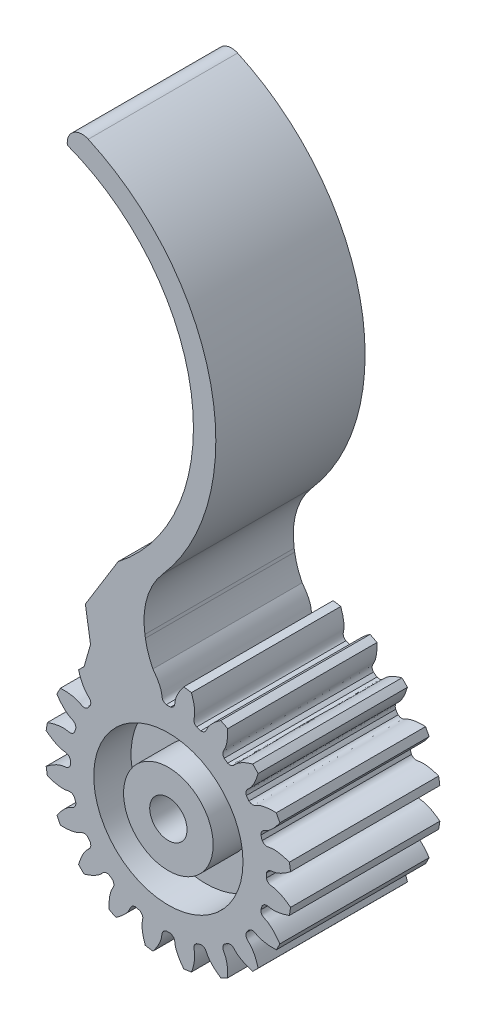
from build123d import *

# Parameters (mm, degrees)
SKETCH_1_R               = 16.5
EXTRUDE_1_DEPTH          = 20
CUT_EXTRUDE_1_DEPTH      = 31.732718721
PATTERN_CIRCULAR_1_COUNT = 20
EXTRUDE_START            = -20
EXTRUDE_2_DEPTH          = 20
FILLET_1_R               = 10
FILLET_2_R               = 2
FILLET_4_R               = 10
SKETCH_5_R               = 2.5
CUT_EXTRUDE_2_DEPTH      = 20
SKETCH_7_R               = 10
CUT_EXTRUDE_3_DEPTH      = 3
CUT_EXTRUDE_START        = -5
SKETCH_8_R               = 10
SKETCH_8_R_2             = 6
CUT_EXTRUDE_4_DEPTH      = 5


with BuildPart() as part:
    # 草图1 → 凸台-拉伸1 (new body)
    with BuildSketch(Plane.XY):
        Circle(SKETCH_1_R)
    extrude(amount=EXTRUDE_1_DEPTH)

    # 草图2 → 切除-拉伸1 (cut, through all)
    with BuildSketch(Plane.XY):
        with BuildLine():
            ThreePointArc((0.289974901, 13.121796354), (0, 13.125), (-0.289974901, 13.121796354))
            add(Edge.make_bspline(
                [(-0.289974901, 13.121796354), (-0.916784107, 13.340213268), (-0.835626149, 13.780670548), (-0.919345585, 14.205014104), (-0.928338279, 14.246334921), (-0.939466335, 14.292951923), (-0.952938145, 14.344795254), (-0.96896871, 14.401787245), (-0.987768083, 14.463844242), (-1.009544807, 14.5308761), (-1.034504625, 14.602786421), (-1.06285065, 14.679472568), (-1.094783098, 14.760825751), (-1.130499153, 14.846731096), (-1.170192797, 14.937067727), (-1.214054647, 15.031708847), (-1.2622718, 15.130521826), (-1.315027675, 15.233368292), (-1.372501858, 15.340104225), (-1.434869948, 15.450580056), (-1.502303414, 15.564640771), (-1.574969439, 15.682126017), (-1.653030782, 15.802870208), (-1.736645634, 15.926702646), (-1.825967477, 16.05344763), (-1.921144951, 16.182924586), (-2.022321721, 16.314948181), (-2.129636342, 16.449328459), (-2.24322214, 16.585870967), (-2.363207078, 16.724376892), (-2.489713645, 16.864643194), (-2.622858733, 17.006462752), (-2.762753527, 17.149624504), (-2.909503389, 17.29391359), (-3.06320776, 17.439111509), (-3.223960048, 17.584996263), (-3.391847534, 17.731342516), (-3.566951278, 17.877921749), (-3.749346018, 18.024502419), (-3.939100102, 18.170850122), (-4.136275349, 18.31672776), (-4.412210386, 18.512459802), (-4.625898619, 18.654498902), (-4.771736973, 18.747377789)],
                knots=[0, 0, 0, 0, 0.165916003, 0.170905922, 0.176663519, 0.183188797, 0.190481754, 0.198542391, 0.207370708, 0.216966704, 0.22733038, 0.238461736, 0.250360771, 0.263027487, 0.276461881, 0.290663956, 0.30563371, 0.321371144, 0.337876258, 0.355149051, 0.373189524, 0.391997677, 0.411573509, 0.431917021, 0.453028213, 0.474907084, 0.497553636, 0.520967867, 0.545149777, 0.570099367, 0.595816637, 0.622301587, 0.649554216, 0.677574526, 0.706362514, 0.735918183, 0.766241531, 0.797332559, 0.829191267, 0.861817654, 0.895211721, 0.929373468, 1, 1, 1, 1], degree=3))
            ThreePointArc((-4.771736973, 18.747377789), (0, 19.345119481), (4.771736973, 18.747377789))
            add(Edge.make_bspline(
                [(0.289974901, 13.121796354), (0.916784107, 13.340213268), (0.835626149, 13.780670548), (0.919345585, 14.205014104), (0.928338279, 14.246334921), (0.939466335, 14.292951923), (0.952938145, 14.344795254), (0.96896871, 14.401787245), (0.987768083, 14.463844242), (1.009544807, 14.5308761), (1.034504625, 14.602786421), (1.06285065, 14.679472568), (1.094783098, 14.760825751), (1.130499153, 14.846731096), (1.170192797, 14.937067727), (1.214054647, 15.031708847), (1.2622718, 15.130521826), (1.315027675, 15.233368292), (1.372501858, 15.340104225), (1.434869948, 15.450580056), (1.502303414, 15.564640771), (1.574969439, 15.682126017), (1.653030782, 15.802870208), (1.736645634, 15.926702646), (1.825967477, 16.05344763), (1.921144951, 16.182924586), (2.022321721, 16.314948181), (2.129636342, 16.449328459), (2.24322214, 16.585870967), (2.363207078, 16.724376892), (2.489713645, 16.864643194), (2.622858733, 17.006462752), (2.762753527, 17.149624504), (2.909503389, 17.29391359), (3.06320776, 17.439111509), (3.223960048, 17.584996263), (3.391847534, 17.731342516), (3.566951278, 17.877921749), (3.749346018, 18.024502419), (3.939100102, 18.170850122), (4.136275349, 18.31672776), (4.412210386, 18.512459802), (4.625898619, 18.654498902), (4.771736973, 18.747377789)],
                knots=[0, 0, 0, 0, 0.165916003, 0.170905922, 0.176663519, 0.183188797, 0.190481754, 0.198542391, 0.207370708, 0.216966704, 0.22733038, 0.238461736, 0.250360771, 0.263027487, 0.276461881, 0.290663956, 0.30563371, 0.321371144, 0.337876258, 0.355149051, 0.373189524, 0.391997677, 0.411573509, 0.431917021, 0.453028213, 0.474907084, 0.497553636, 0.520967867, 0.545149777, 0.570099367, 0.595816637, 0.622301587, 0.649554216, 0.677574526, 0.706362514, 0.735918183, 0.766241531, 0.797332559, 0.829191267, 0.861817654, 0.895211721, 0.929373468, 1, 1, 1, 1], degree=3))
        make_face()
    cut_extrude_1 = extrude(amount=CUT_EXTRUDE_1_DEPTH, mode=Mode.SUBTRACT)

    # 阵列(圆周)1: 切除-拉伸1 ×20 about axis
    pattern_circular_1_axis = Axis((0, 0, -1.5), (0, 0, 1))
    for i in range(1, PATTERN_CIRCULAR_1_COUNT):
        add(cut_extrude_1.rotate(pattern_circular_1_axis, i * 360 / PATTERN_CIRCULAR_1_COUNT), mode=Mode.SUBTRACT)


with BuildPart() as extrude_2_tool:
    # 草图4 → 凸台-拉伸2 (new body)
    with BuildSketch(Plane.XY.offset(20).offset(EXTRUDE_START)):
        with BuildLine():
            Line((-3.093231062, 16.207464996), (-2.581168673, 16.29685762))
            Line((-2.581168673, 16.29685762), (-3.943179305, 24.896254312))
            ThreePointArc((-3.943179305, 24.896254312), (5.496479925, 54.08322336), (-16.546718658, 75.415914817))
            Line((-16.546718658, 75.415914817), (-13.532827403, 71.415914817))
            ThreePointArc((-13.532827403, 71.415914817), (3.341214432, 48.022182491), (-11.762983934, 23.448554518))
            Line((-11.762983934, 23.448554518), (-10.429455191, 15.028985398))
            Line((-10.429455191, 15.028985398), (-9.866251186, 11.473055258))
            add(Edge.make_bspline(
                [(-9.86625116, 11.473055308), (-9.818790017, 11.447845476), (-9.715705209, 11.391138486), (-9.589612349, 11.315967266), (-9.466858859, 11.237556123), (-9.37982057, 11.17834971), (-9.300755502, 11.120900284), (-9.249070303, 11.081745113), (-9.202602252, 11.045060153), (-9.150343301, 11.002082969), (-9.104978437, 10.962582681), (-8.776110671, 10.657627941), (-8.582874544, 10.253587065), (-7.947393003, 10.445313277)],
                knots=[0.701586416, 0.701586416, 0.701586416, 0.701586416, 0.723538119, 0.749639229, 0.761538264, 0.783033296, 0.792629292, 0.801457609, 0.809518246, 0.816811203, 0.829094078, 0.834083997, 1, 1, 1, 1], degree=3))
            ThreePointArc((-7.947393003, 10.445313277), (-7.714681436, 10.618348051), (-7.478203758, 10.786199217))
            add(Edge.make_bspline(
                [(-7.478203758, 10.786199217), (-7.099486698, 11.33133142), (-7.424039159, 11.639965394), (-7.612442624, 12.046973423), (-7.635991116, 12.102324233), (-7.660715943, 12.16530613), (-7.681245996, 12.220836149), (-7.71083511, 12.306060717), (-7.748703597, 12.427161912), (-7.792731572, 12.590510669), (-7.835215538, 12.777480211), (-7.874329115, 12.988173006), (-7.908236264, 13.222583157), (-7.935097524, 13.480595599), (-7.953075711, 13.761985925), (-7.960341751, 14.066420428), (-7.956565619, 14.30111124), (-7.951281332, 14.434194698), (-7.950219677, 14.458354231)],
                knots=[0, 0, 0, 0, 0.165916003, 0.170905922, 0.183188797, 0.190481754, 0.198542391, 0.207370708, 0.22733038, 0.250360771, 0.276461881, 0.30563371, 0.337876258, 0.373189524, 0.411573509, 0.453028213, 0.497553636, 0.507431698, 0.507431698, 0.507431698, 0.507431698], degree=3))
            ThreePointArc((-7.950219677, 14.458354231), (-7.490843246, 14.701607649), (-7.024032405, 14.930270218))
            add(Edge.make_bspline(
                [(-7.024032405, 14.930270218), (-6.912948778, 14.856790614), (-6.720224904, 14.722766352), (-6.458979768, 14.52326582), (-6.24189748, 14.343324096), (-6.048949658, 14.169936981), (-5.879237949, 14.004722705), (-5.731774221, 13.849237063), (-5.623437121, 13.725477592), (-5.530921989, 13.612971249), (-5.466439445, 13.529766293), (-5.408996946, 13.450696193), (-5.371941014, 13.397485807), (-5.339083547, 13.34823692), (-5.302663012, 13.291214284), (-5.271724722, 13.239628764), (-5.053189088, 12.847973843), (-4.994266108, 12.403994888), (-4.330640589, 12.389962756)],
                knots=[0.492568302, 0.492568302, 0.492568302, 0.492568302, 0.546971787, 0.588426491, 0.626810476, 0.662123742, 0.69436629, 0.723538119, 0.749639229, 0.761538264, 0.783033296, 0.792629292, 0.801457609, 0.809518246, 0.816811203, 0.829094078, 0.834083997, 1, 1, 1, 1], degree=3))
            ThreePointArc((-4.330640589, 12.389962756), (-4.055848051, 12.482616776), (-3.779075551, 12.5691771))
            add(Edge.make_bspline(
                [(-3.779075551, 12.5691771), (-3.250439109, 12.970598627), (-3.463733699, 13.364419205), (-3.517143644, 13.809726715), (-3.522435249, 13.869645348), (-3.526487481, 13.937185083), (-3.528853002, 13.996341404), (-3.530658082, 14.086538325), (-3.529250826, 14.213414411), (-3.520646377, 14.382373703), (-3.503274264, 14.573320573), (-3.475365832, 14.785788088), (-3.435176726, 15.019203275), (-3.380993074, 15.272888275), (-3.311136952, 15.546061943), (-3.223971932, 15.837841691), (-3.147857168, 16.059879028), (-3.101706462, 16.184815984), (-3.093231062, 16.207464996)],
                knots=[0, 0, 0, 0, 0.165916003, 0.170905922, 0.183188797, 0.190481754, 0.198542391, 0.207370708, 0.22733038, 0.250360771, 0.276461881, 0.30563371, 0.337876258, 0.373189524, 0.411573509, 0.453028213, 0.497553636, 0.507431698, 0.507431698, 0.507431698, 0.507431698], degree=3))
        make_face()
        with BuildLine():
            Line((-9.866251186, 11.473055258), (-10.429455191, 15.028985398))
            Line((-10.429455191, 15.028985398), (-11.293959017, 12.028985398))
            add(Edge.make_bspline(
                [(-11.293959017, 12.028985398), (-11.165605763, 11.993428871), (-10.940898693, 11.925519176), (-10.630790749, 11.816512081), (-10.368728174, 11.712459448), (-10.131644325, 11.607182659), (-9.967401155, 11.526255764), (-9.881861585, 11.481347063), (-9.86625116, 11.473055308)],
                knots=[0.492568302, 0.492568302, 0.492568302, 0.492568302, 0.546971787, 0.588426491, 0.626810476, 0.662123742, 0.69436629, 0.701586416, 0.701586416, 0.701586416, 0.701586416], degree=3))
        make_face()
    extrude(amount=EXTRUDE_2_DEPTH)


with BuildPart() as part_1:
    add(part.part)


with BuildPart() as part_2:
    # 凸台-拉伸2: joined with extrude_2_tool
    add(part_1.part.fuse(extrude_2_tool.part, tol=0.00001))

    # 圆角1
    # the kernel refuses this fillet: 10 mm, written as the material it adds along each edge
    with BuildSketch(Plane(origin=(-2.581168673, 16.29685762, 0), x_dir=(0.9900299133467211, 0.14085727059219932, 0), z_dir=(0, 0, 1))) as fillet_1_piece_1:
        with BuildLine():
            CenterArc((9.948767375, 3.330870643), FILLET_1_R, 180.902544173, 18.55371105)
            Line((-0.049991965, 3.173353483), (-0.249967152, 3.17020314))
            Line((-0.249967152, 3.17020314), (-0.199975187, -0.003150343))
            Line((-0.199975187, -0.003150343), (0.003150343, -0.199975187))
            ThreePointArc((0.003150343, -0.199975187), (0.259903314, -0.197952911), (0.331227414, -0.066617413))
            Line((0.331227414, -0.066617413), (0.519806629, 0))
        make_face()
    extrude(amount=20)

    # 圆角2
    # the kernel refuses this fillet: 2 mm, written as the material it takes off along each edge
    with BuildSketch(Plane(origin=(-16.546718658, 75.415914817, -15.309873944), x_dir=(0.9500150580414196, -0.3122040830843792, 0), z_dir=(0, 0, 1))) as fillet_2_piece_1:
        with BuildLine():
            CenterArc((5.912778903, -1.988820491), FILLET_2_R, 83.939108601, 121.855430824)
            Line((4.112058409, -2.859111076), (4.076043999, -2.876516888))
            ThreePointArc((4.076043999, -2.876516888), (2.033194436, -1.462397179), (-0.022834768, -0.032841641))
            Line((-0.022834768, -0.032841641), (-0.004223414, 0.03977641))
            ThreePointArc((-0.004223414, 0.03977641), (3.061974789, 0.202102878), (6.128172991, 0.03977641))
            Line((6.128172991, 0.03977641), (6.123949578, 0))
        make_face()
    extrude(amount=50.619747889, mode=Mode.SUBTRACT)

    # 圆角4
    fillet_4_edges = [part_2.edges().sort_by_distance(p)[0] for p in [
        (-3.943179305, 24.896254312, 10),
    ]]
    fillet(fillet_4_edges, radius=FILLET_4_R)

    # 草图5 → 切除-拉伸2 (cut)
    with BuildSketch(Plane.XY.offset(20)):
        Circle(SKETCH_5_R)
    extrude(amount=-CUT_EXTRUDE_2_DEPTH, mode=Mode.SUBTRACT)

    # 倒角1
    # the kernel refuses this chamfer: 7.231890237, 5 mm, written as the material it takes off along each edge
    with BuildSketch(Plane(origin=(-11.762983934, 23.448554518, -15.355722495), x_dir=(0.8550981563883064, 0.5184661444504544, 0), z_dir=(0, 0, 1))) as chamfer_1_piece_1:
        with BuildLine():
            Line((6.140873696, 0.131849833), (-1.814656366, -3.942000238))
            Line((-1.814656366, -3.942000238), (-1.948544176, -3.887281421))
            ThreePointArc((-1.948544176, -3.887281421), (-0.953988417, -1.951930476), (-0.13388781, 0.054718816))
            Line((-0.13388781, 0.054718816), (0.016364637, 0.143709057))
            ThreePointArc((0.016364637, 0.143709057), (3.070876099, -0.021990502), (6.124509059, 0.27555889))
            Line((6.124509059, 0.27555889), (6.140873696, 0.131849833))
        make_face()
    extrude(amount=50.71144499, mode=Mode.SUBTRACT)

    # 草图7 → 切除-拉伸3 (cut)
    with BuildSketch(Plane(origin=(0, 0, 0), x_dir=(-1, 0, 0), z_dir=(0, 0, -1))):
        Circle(SKETCH_7_R)
    extrude(amount=-CUT_EXTRUDE_3_DEPTH, mode=Mode.SUBTRACT)

    # 草图8 → 切除-拉伸4 (cut)
    with BuildSketch(Plane.XY.offset(20).offset(CUT_EXTRUDE_START)):
        with Locations(Location((0, 0, 0), (0, 0, 180))):
            Circle(SKETCH_8_R)
        Circle(SKETCH_8_R_2, mode=Mode.SUBTRACT)
    extrude(amount=CUT_EXTRUDE_4_DEPTH, mode=Mode.SUBTRACT)


solid = part_2.part
